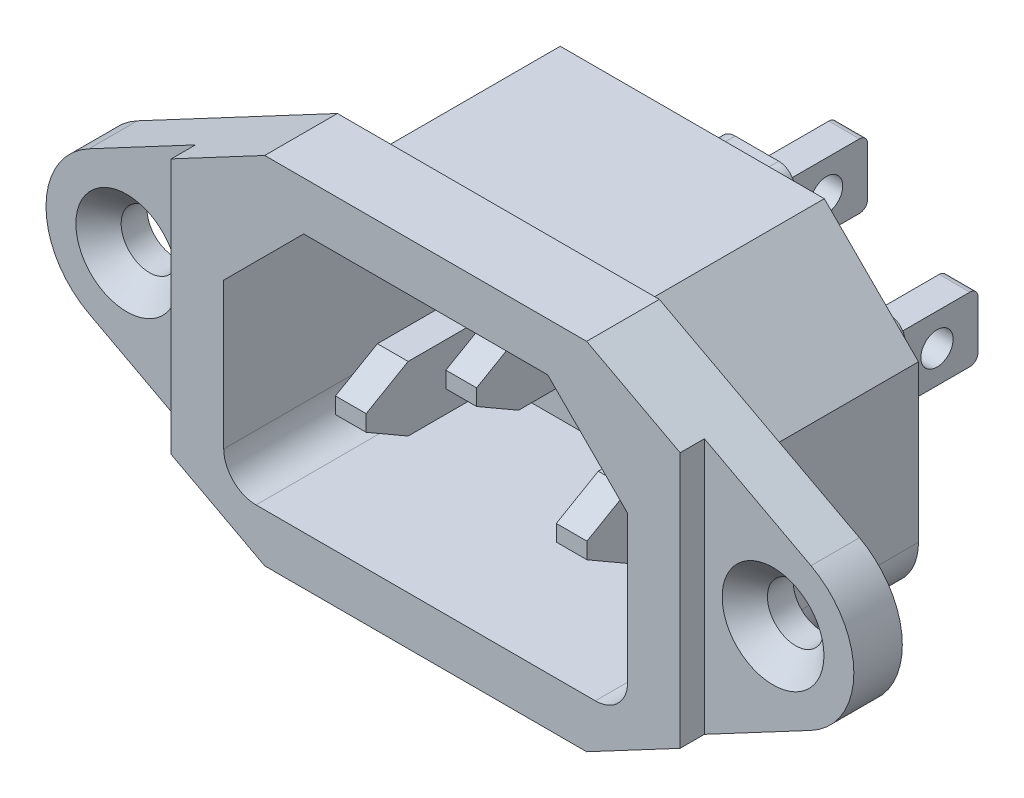
from build123d import *

# Parameters (mm, degrees)
SKETCH1_R                  = 1.75
BOSS_EXTRUDE1_DEPTH        = 3
BOSS_EXTRUDE2_START        = 1.5
BOSS_EXTRUDE2_DEPTH        = 1.5
BOSS_EXTRUDE3_DEPTH        = 15
BOSS_EXTRUDE4_START        = -2.5
BOSS_EXTRUDE4_DEPTH        = 2.5
CHAMFER2_SIZE              = 1.4
SKETCH4_W                  = 1.9
SKETCH4_H                  = 4
BOSS_EXTRUDE5_DEPTH        = 4
SKETCH4_2_W                = 1.9
SKETCH4_2_H                = 4
CUT_EXTRUDE1_DEPTH         = 32.910029771
BOSS_EXTRUDE6_DEPTH        = 9.9
BOSS_EXTRUDE6_DEPTH_BACK   = 14.3
SKETCH4_3_W                = 1.9
SKETCH4_3_H                = 4
BOSS_EXTRUDE6_2_DEPTH      = 9.9
BOSS_EXTRUDE6_2_DEPTH_BACK = 14.3
BOSS_EXTRUDE6_3_DEPTH      = 9.9
BOSS_EXTRUDE6_3_DEPTH_BACK = 14.3
FILLET1_R                  = 0.5
FILLET2_R                  = 0.5
FILLET3_R                  = 0.5
CUT_EXTRUDE2_DEPTH         = 37.959572508
CUT_EXTRUDE2_DEPTH_BACK    = 37.959572508
SKETCH5_R                  = 1
CHAMFER3_SIZE              = 1.5
CHAMFER3_SIZE2             = 2.598076211
CHAMFER4_SIZE              = 1.5
CHAMFER4_SIZE2             = 2.598076211
CHAMFER5_SIZE              = 1.5
CHAMFER5_SIZE2             = 2.598076211


with BuildPart() as part:
    # Sketch1 → Boss-Extrude1 (new body)
    with BuildSketch(Plane.XY):
        with BuildLine():
            Line((9.962281222, 11), (0, 11))
            Line((0, 11), (0, 8))
            Line((0, 8), (7.550252532, 8))
            Line((7.550252532, 8), (12.5, 3.050252532))
            Line((12.5, 3.050252532), (12.5, -6))
            ThreePointArc((12.5, -6), (11.914213562, -7.414213562), (10.5, -8))
            Line((10.5, -8), (0, -8))
            Line((0, -8), (0, -11))
            Line((0, -11), (9.962281222, -11))
            Line((9.962281222, -11), (22.347357814, -4.414737964))
            ThreePointArc((22.347357814, -4.414737964), (25, 0), (22.347357814, 4.414737964))
            Line((22.347357814, 4.414737964), (9.962281222, 11))
        make_face()
        with Locations((20, 0)):
            Circle(SKETCH1_R, mode=Mode.SUBTRACT)
    extrude(amount=-BOSS_EXTRUDE1_DEPTH)

    # Sketch1<3> → Boss-Extrude2 (add)
    with BuildSketch(Plane.XY.offset(BOSS_EXTRUDE2_START)):
        with BuildLine():
            Line((15.75, 7.922615338), (9.962281222, 11))
            Line((9.962281222, 11), (0, 11))
            Line((0, 11), (0, 8))
            Line((0, 8), (7.550252532, 8))
            Line((7.550252532, 8), (12.5, 3.050252532))
            Line((12.5, 3.050252532), (12.5, -6))
            ThreePointArc((12.5, -6), (11.914213562, -7.414213562), (10.5, -8))
            Line((10.5, -8), (0, -8))
            Line((0, -8), (0, -11))
            Line((0, -11), (9.962281222, -11))
            Line((9.962281222, -11), (15.75, -7.922615338))
            Line((15.75, -7.922615338), (15.75, 7.922615338))
        make_face()
    extrude(amount=-BOSS_EXTRUDE2_DEPTH)

    # Sketch1<4> → Boss-Extrude3 (add)
    with BuildSketch(Plane.XY):
        with BuildLine():
            Line((8.171572875, 9.5), (0, 9.5))
            Line((0, 9.5), (0, 8))
            Line((0, 8), (7.550252532, 8))
            Line((7.550252532, 8), (12.5, 3.050252532))
            Line((12.5, 3.050252532), (12.5, -6))
            ThreePointArc((12.5, -6), (11.914213562, -7.414213562), (10.5, -8))
            Line((10.5, -8), (0, -8))
            Line((0, -8), (0, -9.5))
            Line((0, -9.5), (10.5, -9.5))
            ThreePointArc((10.5, -9.5), (12.974873734, -8.474873734), (14, -6))
            Line((14, -6), (14, 3.671572875))
            Line((14, 3.671572875), (8.171572875, 9.5))
        make_face()
    extrude(amount=-BOSS_EXTRUDE3_DEPTH)

    # Sketch2 → Boss-Extrude4 (add)
    with BuildSketch(Plane(origin=(0, 0, -15), x_dir=(-1, 0, 0), z_dir=(0, 0, -1)).offset(BOSS_EXTRUDE4_START)):
        with BuildLine():
            Line((0, 9.5), (-8.171572875, 9.5))
            Line((-8.171572875, 9.5), (-14, 3.671572875))
            Line((-14, 3.671572875), (-14, -6))
            ThreePointArc((-14, -6), (-12.974873734, -8.474873734), (-10.5, -9.5))
            Line((-10.5, -9.5), (0, -9.5))
            Line((0, -9.5), (0, 9.5))
        make_face()
    extrude(amount=BOSS_EXTRUDE4_DEPTH)

    # Chamfer2
    chamfer2_edges = [part.edges().sort_by_distance(p)[0] for p in [
        (18.25, 0, 0),
    ]]
    chamfer(chamfer2_edges, length=CHAMFER2_SIZE)

    # Mirror1: part across plane


with BuildPart() as part_1:
    add(part.part)
    add(part.part.mirror(Plane(origin=(0, 0, 0), x_dir=(0, 0, 1), z_dir=(1, 0, 0))))

    # Sketch4 → Boss-Extrude5 (add)
    # profile 1 of 3: a face of its own
    with BuildSketch(Plane(origin=(0, 0, -15), x_dir=(-1, 0, 0), z_dir=(0, 0, -1))):
        with BuildLine():
            Line((-1.35, 6.1), (1.35, 6.1))
            ThreePointArc((1.35, 6.1), (2.057106781, 5.807106781), (2.35, 5.1))
            Line((2.35, 5.1), (2.35, -0.3))
            ThreePointArc((2.35, -0.3), (2.057106781, -1.007106781), (1.35, -1.3))
            Line((1.35, -1.3), (-1.35, -1.3))
            ThreePointArc((-1.35, -1.3), (-2.057106781, -1.007106781), (-2.35, -0.3))
            Line((-2.35, -0.3), (-2.35, 5.1))
            ThreePointArc((-2.35, 5.1), (-2.057106781, 5.807106781), (-1.35, 6.1))
        make_face()
        with Locations((0, 2.4)):
            Rectangle(SKETCH4_W, SKETCH4_H, mode=Mode.SUBTRACT)
    # profile 2 of 3: a face of its own
    with BuildSketch(Plane(origin=(0, 0, -15), x_dir=(-1, 0, 0), z_dir=(0, 0, -1))):
        with BuildLine():
            Line((-8.184232728, 1.3), (-5.484232728, 1.3))
            ThreePointArc((-5.484232728, 1.3), (-4.777125947, 1.007106781), (-4.484232728, 0.3))
            Line((-4.484232728, 0.3), (-4.484232728, -5.1))
            ThreePointArc((-4.484232728, -5.1), (-4.777125947, -5.807106781), (-5.484232728, -6.1))
            Line((-5.484232728, -6.1), (-8.184232728, -6.1))
            ThreePointArc((-8.184232728, -6.1), (-8.891339509, -5.807106781), (-9.184232728, -5.1))
            Line((-9.184232728, -5.1), (-9.184232728, 0.3))
            ThreePointArc((-9.184232728, 0.3), (-8.891339509, 1.007106781), (-8.184232728, 1.3))
        make_face()
        with Locations((-6.834232728, -2.4)):
            Rectangle(SKETCH4_W, SKETCH4_H, mode=Mode.SUBTRACT)
    # profile 3 of 3: a face of its own
    with BuildSketch(Plane(origin=(0, 0, -15), x_dir=(-1, 0, 0), z_dir=(0, 0, -1))):
        with BuildLine():
            Line((5.484232728, 1.3), (8.184232728, 1.3))
            ThreePointArc((8.184232728, 1.3), (8.891339509, 1.007106781), (9.184232728, 0.3))
            Line((9.184232728, 0.3), (9.184232728, -5.1))
            ThreePointArc((9.184232728, -5.1), (8.891339509, -5.807106781), (8.184232728, -6.1))
            Line((8.184232728, -6.1), (5.484232728, -6.1))
            ThreePointArc((5.484232728, -6.1), (4.777125947, -5.807106781), (4.484232728, -5.1))
            Line((4.484232728, -5.1), (4.484232728, 0.3))
            ThreePointArc((4.484232728, 0.3), (4.777125947, 1.007106781), (5.484232728, 1.3))
        make_face()
        with Locations((6.834232728, -2.4)):
            Rectangle(SKETCH4_W, SKETCH4_H, mode=Mode.SUBTRACT)
    extrude(amount=BOSS_EXTRUDE5_DEPTH)

    # Sketch4<2> → Cut-Extrude1 (cut, through all)
    with BuildSketch(Plane(origin=(0, 0, -15), x_dir=(-1, 0, 0), z_dir=(0, 0, -1))):
        with Locations((0, 2.4)):
            Rectangle(SKETCH4_2_W, SKETCH4_2_H)
        with Locations((-6.834232728, -2.4)):
            Rectangle(SKETCH4_2_W, SKETCH4_2_H)
        with Locations((6.834232728, -2.4)):
            Rectangle(SKETCH4_2_W, SKETCH4_2_H)
    extrude(amount=-CUT_EXTRUDE1_DEPTH, mode=Mode.SUBTRACT)


with BuildPart() as body_2:
    # Sketch4<3> → Boss-Extrude6 (new, two sides: drawn at the far end of the back side and taken through both)
    with BuildSketch(Plane(origin=(0, 0, -15), x_dir=(-1, 0, 0), z_dir=(0, 0, -1)).offset(-BOSS_EXTRUDE6_DEPTH_BACK)):
        with Locations((0, 2.4)):
            Rectangle(SKETCH4_3_W, SKETCH4_3_H)
    extrude(amount=BOSS_EXTRUDE6_DEPTH + BOSS_EXTRUDE6_DEPTH_BACK)

    # Fillet2
    fillet2_edges = [body_2.edges().sort_by_distance(p)[0] for p in [
        (0, 4.4, -24.9),
        (0, 0.4, -24.9),
    ]]
    fillet(fillet2_edges, radius=FILLET2_R)


with BuildPart() as body_3:
    # Sketch4<3> → Boss-Extrude6 2 (new, two sides: drawn at the far end of the back side and taken through both)
    with BuildSketch(Plane(origin=(0, 0, -15), x_dir=(-1, 0, 0), z_dir=(0, 0, -1)).offset(-BOSS_EXTRUDE6_2_DEPTH_BACK)):
        with Locations((-6.834232728, -2.4)):
            Rectangle(SKETCH4_3_W, SKETCH4_3_H)
    extrude(amount=BOSS_EXTRUDE6_2_DEPTH + BOSS_EXTRUDE6_2_DEPTH_BACK)

    # Fillet1
    fillet1_edges = [body_3.edges().sort_by_distance(p)[0] for p in [
        (6.834232728, -0.4, -24.9),
        (6.834232728, -4.4, -24.9),
    ]]
    fillet(fillet1_edges, radius=FILLET1_R)


with BuildPart() as body_4:
    # Sketch4<3> → Boss-Extrude6 3 (new, two sides: drawn at the far end of the back side and taken through both)
    with BuildSketch(Plane(origin=(0, 0, -15), x_dir=(-1, 0, 0), z_dir=(0, 0, -1)).offset(-BOSS_EXTRUDE6_3_DEPTH_BACK)):
        with Locations((6.834232728, -2.4)):
            Rectangle(SKETCH4_3_W, SKETCH4_3_H)
    extrude(amount=BOSS_EXTRUDE6_3_DEPTH + BOSS_EXTRUDE6_3_DEPTH_BACK)

    # Fillet3
    fillet3_edges = [body_4.edges().sort_by_distance(p)[0] for p in [
        (-6.834232728, -0.4, -24.9),
        (-6.834232728, -4.4, -24.9),
    ]]
    fillet(fillet3_edges, radius=FILLET3_R)


with BuildPart() as cut_extrude2_tool:
    # Sketch5 → Cut-Extrude2 (new, two sides: drawn at the far end of the back side and taken through both)
    with BuildSketch(Plane(origin=(0, 0, 0), x_dir=(0, 0, -1), z_dir=(1, 0, 0)).offset(-CUT_EXTRUDE2_DEPTH_BACK)):
        with Locations((22.36, 2.4)):
            Circle(SKETCH5_R)
        with Locations((22.36, -2.4)):
            Circle(SKETCH5_R)
    extrude(amount=CUT_EXTRUDE2_DEPTH + CUT_EXTRUDE2_DEPTH_BACK)


with BuildPart() as body_2_1:
    add(body_2.part)

    # Cut-Extrude2: cut by cut_extrude2_tool
    add(cut_extrude2_tool.part, mode=Mode.SUBTRACT)

    # Chamfer4
    chamfer4_edges = [body_2_1.edges().sort_by_distance(p)[0] for p in [
        (0, 4.4, -0.7),
        (0, 0.4, -0.7),
    ]]
    chamfer4_side = [body_2_1.faces().sort_by_distance(p)[0] for p in [
        (0, 2.4, -0.7),
    ]]
    chamfer(chamfer4_edges, length=CHAMFER4_SIZE, length2=CHAMFER4_SIZE2, reference=chamfer4_side[0])


with BuildPart() as body_3_1:
    add(body_3.part)

    # Cut-Extrude2: cut by cut_extrude2_tool
    add(cut_extrude2_tool.part, mode=Mode.SUBTRACT)

    # Chamfer5
    chamfer5_edges = [body_3_1.edges().sort_by_distance(p)[0] for p in [
        (6.834232728, -0.4, -0.7),
        (6.834232728, -4.4, -0.7),
    ]]
    chamfer5_side = [body_3_1.faces().sort_by_distance(p)[0] for p in [
        (6.834232728, -2.4, -0.7),
    ]]
    chamfer(chamfer5_edges, length=CHAMFER5_SIZE, length2=CHAMFER5_SIZE2, reference=chamfer5_side[0])


with BuildPart() as body_4_1:
    add(body_4.part)

    # Cut-Extrude2: cut by cut_extrude2_tool
    add(cut_extrude2_tool.part, mode=Mode.SUBTRACT)

    # Chamfer3
    chamfer3_edges = [body_4_1.edges().sort_by_distance(p)[0] for p in [
        (-6.834232728, -0.4, -0.7),
        (-6.834232728, -4.4, -0.7),
    ]]
    chamfer3_side = [body_4_1.faces().sort_by_distance(p)[0] for p in [
        (-6.834232728, -2.4, -0.7),
    ]]
    chamfer(chamfer3_edges, length=CHAMFER3_SIZE, length2=CHAMFER3_SIZE2, reference=chamfer3_side[0])


solid = Compound([part_1.part, body_2_1.part, body_3_1.part, body_4_1.part])
